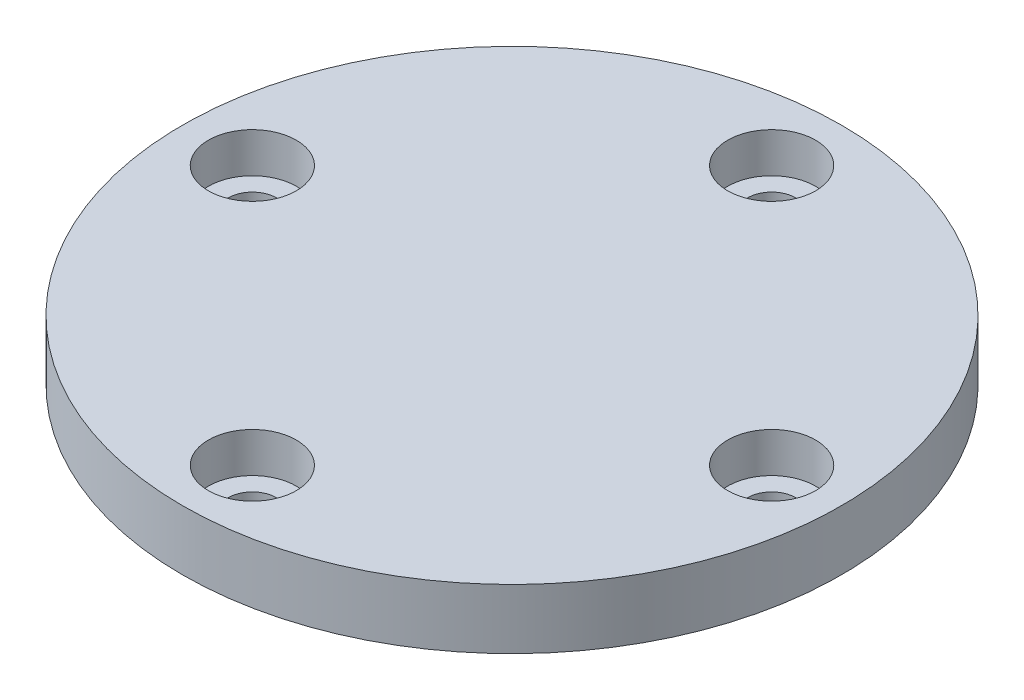
from build123d import *

# Parameters (mm, degrees)
SKETCH1_R                      = 16.5
BOSS_EXTRUDE1_DEPTH            = 3
CBORE_FOR_M2_SHCS1_D           = 2.4
CBORE_FOR_M2_SHCS1_CBORE_D     = 4.4
CBORE_FOR_M2_SHCS1_CBORE_DEPTH = 2
CIRPATTERN1_COUNT              = 4
SKETCH8_R                      = 0.5
CUT_EXTRUDE1_DEPTH             = 1.5


with BuildPart() as part:
    # Sketch1 → Boss-Extrude1 (new body)
    with BuildSketch(Plane(origin=(0, 0, 0), x_dir=(1, 0, 0), z_dir=(0, 1, 0))):
        Circle(SKETCH1_R)
    extrude(amount=BOSS_EXTRUDE1_DEPTH)

    # CBORE for M2 SHCS1 (through all)
    with Locations(Plane(origin=(0, 3, 0), x_dir=(1, 0, 0), z_dir=(0, 1, 0))):
        with Locations((13, 0)):
            cbore_for_m2_shcs1 = CounterBoreHole(CBORE_FOR_M2_SHCS1_D / 2, CBORE_FOR_M2_SHCS1_CBORE_D / 2, CBORE_FOR_M2_SHCS1_CBORE_DEPTH)

    # CirPattern1: CBORE for M2 SHCS1 ×4 about axis
    cirpattern1_axis = Axis((0, 3, 0), (0, 1, 0))
    for i in range(1, CIRPATTERN1_COUNT):
        add(cbore_for_m2_shcs1.rotate(cirpattern1_axis, i * 360 / CIRPATTERN1_COUNT), mode=Mode.SUBTRACT)

    # Sketch8 → Cut-Extrude1 (cut)
    with BuildSketch(Plane.XZ):
        with Locations((6, 0)):
            Circle(SKETCH8_R)
    extrude(amount=-CUT_EXTRUDE1_DEPTH, mode=Mode.SUBTRACT)


solid = part.part
